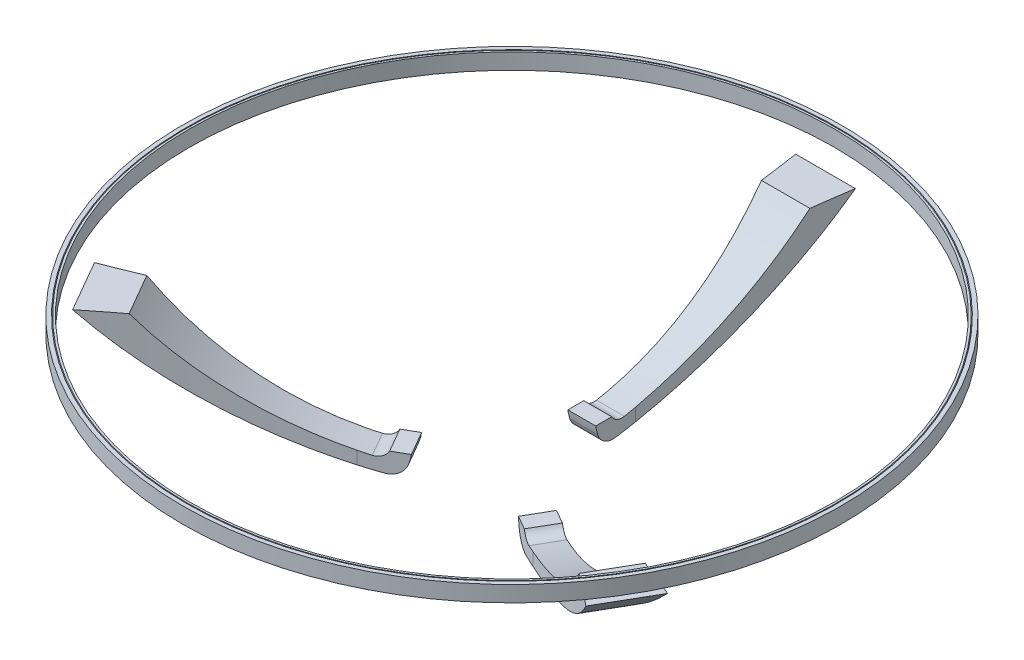
from build123d import *

# Parameters (mm, degrees)
BOSS_EXTRUDE1_START     = -7.5
BOSS_EXTRUDE1_DEPTH     = 15
CUT_EXTRUDE1_DEPTH      = 82.53809146
CUT_EXTRUDE1_DEPTH_BACK = 82.53809146
SKETCH19_OUTSIDE_W      = 30.784
SKETCH19_OUTSIDE_H      = 76.946
CIRPATTERN3_COUNT       = 3
THICKEN1_START          = 24.03491013
THICKEN1_OUTLINE_R      = 81.5
THICKEN1_OUTLINE_R_2    = 81
THICKEN1_DEPTH          = 4
THICKEN2_START          = 24.03491013
THICKEN2_OUTLINE_R      = 82.7
THICKEN2_OUTLINE_R_2    = 81.7
THICKEN2_DEPTH          = 4


with BuildPart() as part:
    # Boss-Extrude1: read off the stored shape, not the designer's step
    # Boss-Extrude1 outline → Boss-Extrude1 (new body)
    with BuildSketch(Plane(origin=(0, 0, 0), x_dir=(0, 0, -1), z_dir=(1, 0, 0)).offset(BOSS_EXTRUDE1_START)):
        with BuildLine():
            ThreePointArc((18.028980942, -5.181901708), (19.709835751, -7.379062069), (22.414512175, -7.960019885))
            ThreePointArc((22.414512175, -7.960019885), (52.80584115, 1.484725187), (78.690598923, 20))
            Line((78.690598923, 20), (68.690598923, 20))
            ThreePointArc((68.690598923, 20), (48.677007473, 4.206743456), (24.710969586, -4.488072412))
            ThreePointArc((24.710969586, -4.488072412), (22.879404453, -4.258455788), (21.528980942, -3))
            Line((21.528980942, -3), (17.528980942, -3))
            ThreePointArc((17.528980942, -3), (17.738223336, -4.100290781), (18.028980942, -5.181901708))
        make_face()
    extrude(amount=BOSS_EXTRUDE1_DEPTH)

    # Sketch19 outside → Cut-Extrude1 (cut, two sides: drawn at the far end of the back side and taken through both)
    with BuildSketch(Plane(origin=(0, 0, 0), x_dir=(1, 0, 0), z_dir=(0, 1, 0)).offset(-CUT_EXTRUDE1_DEPTH_BACK)):
        with Locations((0, 48.11)):
            Rectangle(SKETCH19_OUTSIDE_W, SKETCH19_OUTSIDE_H)
        with BuildLine():
            Line((-3.5, 17.528980942), (-3.5, 27.528980942))
            ThreePointArc((-3.5, 27.528980942), (-4.501523516, 53.187854429), (-7.5, 78.690598923))
            Line((-7.5, 78.690598923), (7.5, 78.690598923))
            ThreePointArc((7.5, 78.690598923), (4.501523516, 53.187854429), (3.5, 27.528980942))
            Line((3.5, 27.528980942), (3.5, 17.528980942))
            Line((3.5, 17.528980942), (-3.5, 17.528980942))
        make_face(mode=Mode.SUBTRACT)
    extrude(amount=CUT_EXTRUDE1_DEPTH + CUT_EXTRUDE1_DEPTH_BACK, mode=Mode.SUBTRACT)


with BuildPart() as cirpattern3_1:
    # CirPattern3: pattern copy
    add(part.part.rotate(Axis((0, 0, 0), (0, 1, 0)), 1 * 360 / CIRPATTERN3_COUNT))


with BuildPart() as cirpattern3_2:
    # CirPattern3: pattern copy
    add(part.part.rotate(Axis((0, 0, 0), (0, 1, 0)), 2 * 360 / CIRPATTERN3_COUNT))


with BuildPart() as body_4:
    # Thicken1: read off the stored shape, not the designer's step
    # Thicken1 outline → Thicken1 (new body)
    with BuildSketch(Plane(origin=(0, 0, 0), x_dir=(1, 0, 0), z_dir=(0, 1, 0)).offset(THICKEN1_START)):
        Circle(THICKEN1_OUTLINE_R)
        Circle(THICKEN1_OUTLINE_R_2, mode=Mode.SUBTRACT)
    extrude(amount=THICKEN1_DEPTH)


with BuildPart() as body_5:
    # Thicken2: read off the stored shape, not the designer's step
    # Thicken2 outline → Thicken2 (new body)
    with BuildSketch(Plane(origin=(0, 0, 0), x_dir=(1, 0, 0), z_dir=(0, 1, 0)).offset(THICKEN2_START)):
        Circle(THICKEN2_OUTLINE_R)
        Circle(THICKEN2_OUTLINE_R_2, mode=Mode.SUBTRACT)
    extrude(amount=THICKEN2_DEPTH)


solid = Compound([part.part, cirpattern3_1.part, cirpattern3_2.part, body_4.part, body_5.part])
